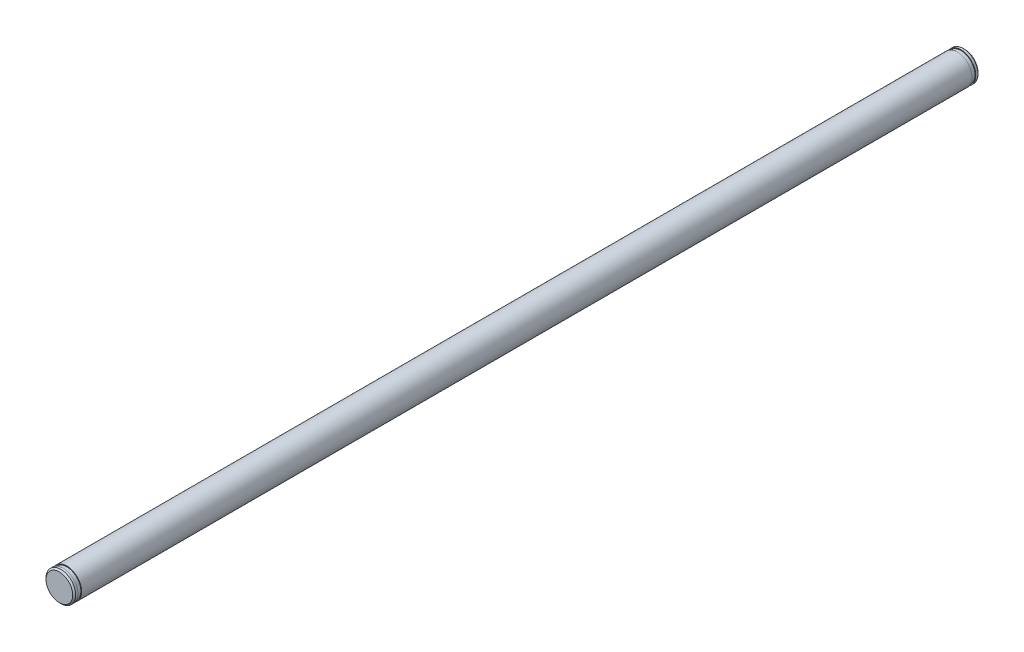
from build123d import *

# Parameters (mm, degrees)
SKIZZE1_R                       = 2
AUFSATZ_LINEAR_AUSTRAGEN1_DEPTH = 61
SKIZZE7_W                       = 0.5
SKIZZE7_H                       = 0.1
FASE1_SIZE                      = 0.2


with BuildPart() as part:
    # Skizze1 → Aufsatz-Linear austragen1 (new, symmetric)
    with BuildSketch(Plane.XY):
        Circle(SKIZZE1_R)
    extrude(amount=AUFSATZ_LINEAR_AUSTRAGEN1_DEPTH, both=True)

    # Skizze7 → Schnitt-Rotation1 (revolve, cut)
    with BuildSketch(Plane(origin=(0, 0, 0), x_dir=(0, 0, -1), z_dir=(1, 0, 0))):
        with Locations((-60.25, 1.95)):
            Rectangle(SKIZZE7_W, SKIZZE7_H)
        with Locations((60.25, 1.95)):
            Rectangle(SKIZZE7_W, SKIZZE7_H)
    revolve(axis=Axis((0, 0, -61), (0, 0, 1)), mode=Mode.SUBTRACT)

    # Fase1
    fase1_edges = [part.edges().sort_by_distance(p)[0] for p in [
        (-2, 0, -61),
        (-2, 0, 61),
    ]]
    chamfer(fase1_edges, length=FASE1_SIZE)


solid = part.part
